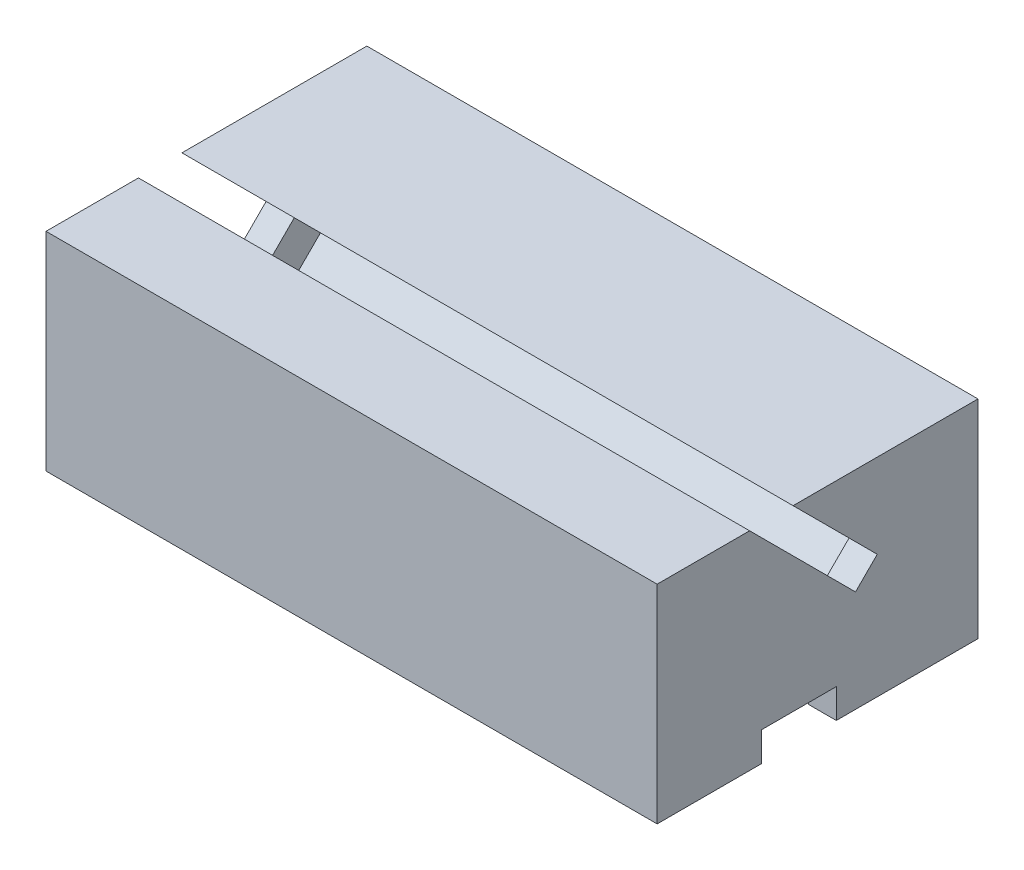
from build123d import *

# Parameters (mm, degrees)
BOSS_EXTRUDE1_DEPTH = 66.1
BOSS_EXTRUDE2_DEPTH = 3.05
BOSS_EXTRUDE3_DEPTH = 3.175
SKETCH2_4_R         = 1.5
CUT_EXTRUDE1_DEPTH  = 3
CHAMFER1_SIZE       = 1.5
CHAMFER3_SIZE       = 3.175


with BuildPart() as part:
    # Sketch1 → Boss-Extrude1 (new body)
    with BuildSketch(Plane(origin=(0, 0, 0), x_dir=(0, 0, -1), z_dir=(1, 0, 0))):
        Polygon((14.702260095, 19.28355698), (34.702260095, 19.28355698), (34.702260095, 0), (0, 0), (0, 19.28355698), (10, 19.28355698), (24.28355698, 5), (26.634687027, 7.351130047), align=None)
    extrude(amount=BOSS_EXTRUDE1_DEPTH)

    # Sketch1<4> → Boss-Extrude2 (add)
    with BuildSketch(Plane(origin=(0, 0, 0), x_dir=(0, 0, -1), z_dir=(1, 0, 0))):
        Polygon((23.806259903, 10.179557172), (21.455129855, 7.828427125), (24.28355698, 5), (26.634687027, 7.351130047), align=None)
    boss_extrude2 = extrude(amount=BOSS_EXTRUDE2_DEPTH)

    # Mirror1: Boss-Extrude2 across plane
    add(boss_extrude2.mirror(Plane.ZY.offset(-33.05)))

    # Sketch2 → Boss-Extrude3 (add)
    with BuildSketch(Plane(origin=(0, 0, 0), x_dir=(1, 0, 0), z_dir=(0, 1, 0))):
        Polygon((0, 11.276130047), (0, 0), (66.1, 0), (66.1, 11.276130047), (63.1, 11.276130047), (63.1, 7.176130047), (3, 7.176130047), (3, 11.276130047), align=None)
        Polygon((0, 34.702260095), (0, 19.376130047), (3, 19.376130047), (3, 27.526130047), (63.1, 27.526130047), (63.1, 19.376130047), (66.1, 19.376130047), (66.1, 34.702260095), align=None)
    extrude(amount=-BOSS_EXTRUDE3_DEPTH)

    # Sketch2<4> → Cut-Extrude1 (cut)
    with BuildSketch(Plane(origin=(0, 0, 0), x_dir=(1, 0, 0), z_dir=(0, 1, 0))):
        with Locations(Location((54.05, 14.176130047, 0), (0, 0, 90))):
            Circle(SKETCH2_4_R)
        with Locations(Location((12.05, 14.176130047, 0), (0, 0, 90))):
            Circle(SKETCH2_4_R)
    extrude(amount=CUT_EXTRUDE1_DEPTH, mode=Mode.SUBTRACT)

    # Chamfer1
    chamfer1_edges = [part.edges().sort_by_distance(p)[0] for p in [
        (54.05, 3, -12.676130047),
        (54.05, 0, -12.676130047),
        (12.05, 0, -12.676130047),
        (12.05, 3, -12.676130047),
    ]]
    chamfer(chamfer1_edges, length=CHAMFER1_SIZE - 0.0001)  # a hair under: the kernel refuses the full size

    # Chamfer3
    chamfer3_edges = [part.edges().sort_by_distance(p)[0] for p in [
        (33.05, 0, -27.526130047),
    ]]
    chamfer(chamfer3_edges, length=CHAMFER3_SIZE - 0.0001)  # a hair under: the kernel refuses the full size


solid = part.part
